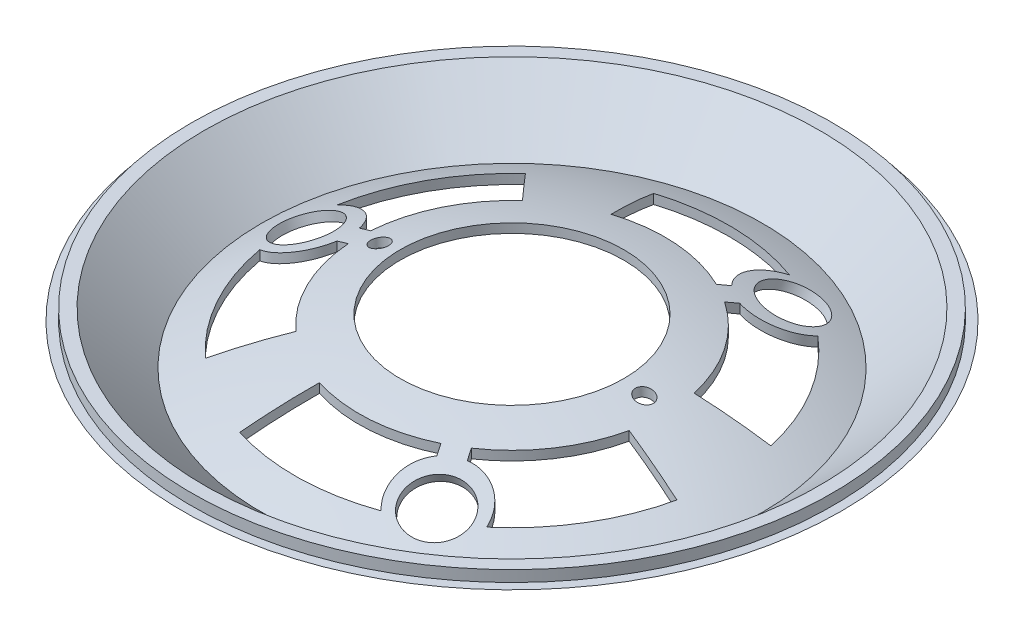
from build123d import *
from OCP.BRepAlgoAPI import BRepAlgoAPI_Cut
from OCP.TopTools import TopTools_ListOfShape

# Parameters (mm, degrees)
PATTERN_CIRCULAR_1_COUNT = 3
SKETCH_3_R               = 2
CUT_EXTRUDE_1_DEPTH      = 169
SKETCH_4_R               = 2
CUT_EXTRUDE_2_DEPTH      = 169
CUT_EXTRUDE_4_DEPTH      = 354
SKETCH_9_R               = 25
CUT_EXTRUDE_5_DEPTH      = 166.443736738


with BuildPart() as part:
    # 草图1 → 旋转1 (revolve)
    with BuildSketch(Plane.XY):
        with BuildLine():
            Line((-58.30765279, 114.509683547), (-56.061132597, 113.399291938))
            ThreePointArc((-56.061132597, 113.399291938), (-28.785756633, 123.181290036), (0, 126.5))
            Line((0, 126.5), (0, 128.5))
            ThreePointArc((0, 128.5), (-29.981291368, 124.953480015), (-58.30765279, 114.509683547))
        make_face()
    revolve(axis=Axis((0, 0, 0), (0, 1, 0)))

    # 草图2 → 切除-旋转1 (revolve, cut)
    with BuildSketch(Plane.XY):
        Polygon((-47.850176119, 124.653970552), (-53.965127913, 122.306660482), (-49.245091626, 110.010545566), (-43.130139832, 112.357855635), align=None)
    cut_revolve_1 = revolve(axis=Axis((0, 0, 0), (-0.3583679495453016, 0.9335804264972013, 0)), mode=Mode.SUBTRACT)

    # 阵列(圆周)1: 切除-旋转1 ×3 about axis
    pattern_circular_1_axis = Axis((0, 114.509683547, 0), (0, -1, 0))
    for i in range(1, PATTERN_CIRCULAR_1_COUNT):
        add(cut_revolve_1.rotate(pattern_circular_1_axis, i * 360 / PATTERN_CIRCULAR_1_COUNT), mode=Mode.SUBTRACT)

    # 草图3 → 切除-拉伸1 (cut)
    with BuildSketch(Plane(origin=(0, 0, 0), x_dir=(1, 0, 0), z_dir=(0, 1, 0))):
        with Locations((-29.6, 0)):
            Circle(SKETCH_3_R)
        with Locations((29.6, 0)):
            Circle(SKETCH_3_R)
    extrude(amount=CUT_EXTRUDE_1_DEPTH, mode=Mode.SUBTRACT)

    # 草图4 → 切除-拉伸2 (cut)
    with BuildSketch(Plane(origin=(0, 0, 0), x_dir=(1, 0, 0), z_dir=(0, 1, 0))):
        Circle(SKETCH_4_R)
    extrude(amount=CUT_EXTRUDE_2_DEPTH, mode=Mode.SUBTRACT)


with BuildPart() as cut_revolve_2_tool:
    # 草图6 → 切除-旋转2 (revolve)
    with BuildSketch(Plane.XY):
        Polygon((-72.5, 124.753817444), (-56.061132597, 113.399291938), (-72.5, 113.399291938), align=None)
    revolve(axis=Axis((0, 169.554002191, 0), (0, -1, 0)))


with BuildPart() as part_1:
    add(part.part)

    # 切除-旋转2: cut by cut_revolve_2_tool, with a tolerance
    cut_revolve_2_stock = TopTools_ListOfShape()
    cut_revolve_2_stock.Append(part_1.part.wrapped)
    cut_revolve_2_tools = TopTools_ListOfShape()
    cut_revolve_2_tools.Append(cut_revolve_2_tool.part.wrapped)
    cut_revolve_2_cut = BRepAlgoAPI_Cut()
    cut_revolve_2_cut.SetArguments(cut_revolve_2_stock)
    cut_revolve_2_cut.SetTools(cut_revolve_2_tools)
    cut_revolve_2_cut.SetFuzzyValue(0.00001)
    cut_revolve_2_cut.Build()
    add(Compound.cast(cut_revolve_2_cut.Shape()).solids(), mode=Mode.REPLACE)


with BuildPart() as revolve_2_tool:
    # 草图7 → 旋转2 (revolve)
    with BuildSketch(Plane.XY):
        Polygon((56.061132597, 113.399291938), (73.7, 124.753817444), (71.7, 124.753817444), (71.7, 127.253817444), (68.785460544, 127.253817444), (54.507599921, 114.310160238), align=None)
    revolve(axis=Axis((0, 167.442227048, 0), (0, -1, 0)))


with BuildPart() as part_2:
    add(part_1.part)


with BuildPart() as part_3:
    # 旋转2: joined with revolve_2_tool
    add(part_2.part.fuse(revolve_2_tool.part, tol=0.00001))

    # 草图8 → 切除-拉伸4 (cut)
    with BuildSketch(Plane(origin=(0, 0, 0), x_dir=(1, 0, 0), z_dir=(0, 1, 0))):
        with BuildLine():
            Line((20.478526668, -30.469848654), (19.231385401, -28.309736615))
            ThreePointArc((19.231385401, -28.309736615), (28.365241903, -19.14942358), (33.446632755, -7.253284016))
            Line((33.446632755, -7.253284016), (47.380284241, -10.498137768))
            ThreePointArc((47.380284241, -10.498137768), (41.548930395, -25.075657806), (31.36864599, -37.028506318))
            ThreePointArc((31.36864599, -37.028506318), (27.279621166, -31.497591576), (20.478526668, -30.469848654))
        make_face()
        with BuildLine():
            Line((16.148399649, -32.969848654), (14.901258382, -30.809736615))
            ThreePointArc((14.901258382, -30.809736615), (2.401266336, -34.139731862), (-10.441788158, -32.592275645))
            Line((-10.441788158, -32.592275645), (-14.598488121, -46.281598675))
            ThreePointArc((-14.598488121, -46.281598675), (0.941691479, -48.520258125), (16.383304141, -45.680297468))
            ThreePointArc((16.383304141, -45.680297468), (13.63790388, -39.373640724), (16.148399649, -32.969848654))
        make_face()
        with BuildLine():
            Line((-36.626926318, -2.5), (-34.132643784, -2.5))
            ThreePointArc((-34.132643784, -2.5), (-30.766508239, -14.990308283), (-23.004844596, -25.338991629))
            Line((-23.004844596, -25.338991629), (-32.78179612, -35.783460907))
            ThreePointArc((-32.78179612, -35.783460907), (-42.490621874, -23.444600319), (-47.75195013, -8.65179115))
            ThreePointArc((-47.75195013, -8.65179115), (-40.917525046, -7.876049147), (-36.626926318, -2.5))
        make_face()
        with BuildLine():
            Line((-36.626926318, 2.5), (-34.132643784, 2.5))
            ThreePointArc((-34.132643784, 2.5), (-30.766508239, 14.990308283), (-23.004844596, 25.338991629))
            Line((-23.004844596, 25.338991629), (-32.78179612, 35.783460907))
            ThreePointArc((-32.78179612, 35.783460907), (-42.490621874, 23.444600319), (-47.75195013, 8.65179115))
            ThreePointArc((-47.75195013, 8.65179115), (-40.917525046, 7.876049147), (-36.626926318, 2.5))
        make_face()
        with BuildLine():
            Line((16.148399649, 32.969848654), (14.901258382, 30.809736615))
            ThreePointArc((14.901258382, 30.809736615), (2.401266336, 34.139731862), (-10.441788158, 32.592275645))
            Line((-10.441788158, 32.592275645), (-14.598488121, 46.281598675))
            ThreePointArc((-14.598488121, 46.281598675), (0.941691479, 48.520258125), (16.383304141, 45.680297468))
            ThreePointArc((16.383304141, 45.680297468), (13.63790388, 39.373640724), (16.148399649, 32.969848654))
        make_face()
        with BuildLine():
            Line((20.478526668, 30.469848654), (19.231385401, 28.309736615))
            ThreePointArc((19.231385401, 28.309736615), (28.365241903, 19.14942358), (33.446632755, 7.253284016))
            Line((33.446632755, 7.253284016), (47.380284241, 10.498137768))
            ThreePointArc((47.380284241, 10.498137768), (41.548930395, 25.075657806), (31.36864599, 37.028506318))
            ThreePointArc((31.36864599, 37.028506318), (27.279621166, 31.497591576), (20.478526668, 30.469848654))
        make_face()
    extrude(amount=CUT_EXTRUDE_4_DEPTH, mode=Mode.SUBTRACT)

    # 草图9 → 切除-拉伸5 (cut, through all)
    with BuildSketch(Plane(origin=(0, 0, 0), x_dir=(1, 0, 0), z_dir=(0, 1, 0))):
        Circle(SKETCH_9_R)
    extrude(amount=CUT_EXTRUDE_5_DEPTH, mode=Mode.SUBTRACT)


solid = part_3.part
